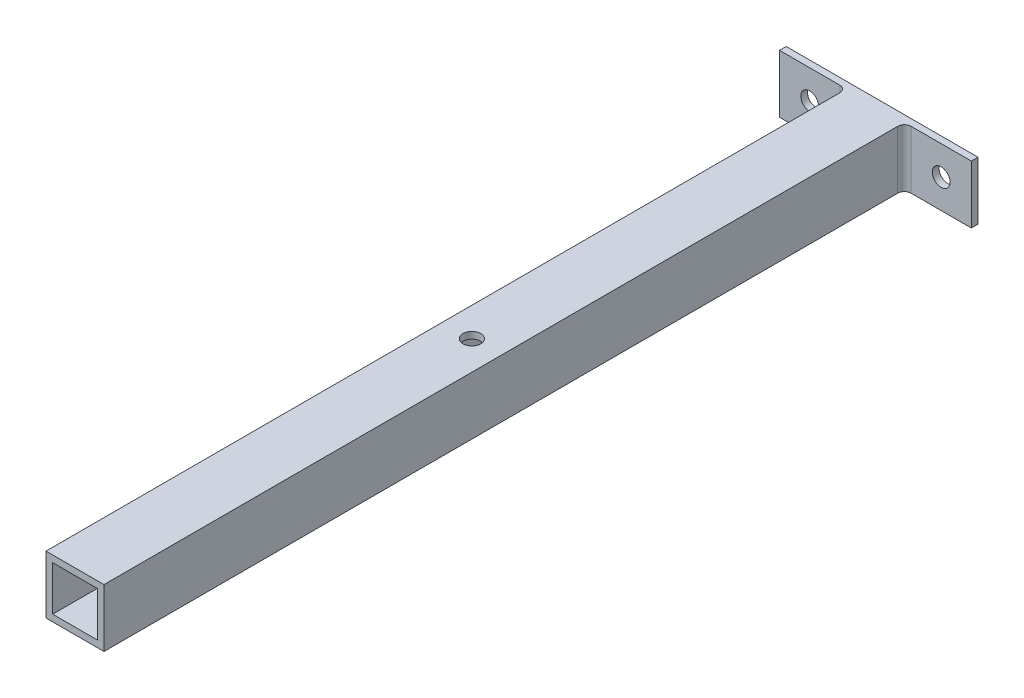
from build123d import *

# Parameters (mm, degrees)
BOSS_EXTRUDE1_DEPTH = 26
SHELL1_START        = -10
SHELL1_OUTLINE_W    = 20
SHELL1_OUTLINE_H    = 362
SHELL1_DEPTH        = 20
FILLET1_R           = 3
SKETCH3_R           = 4
CUT_EXTRUDE1_DEPTH  = 3
SKETCH4_R           = 4
CUT_EXTRUDE2_DEPTH  = 37


# Read off the part's stored shape, not the designer's step: Shell1
with BuildPart() as part:
    # Sketch2 → Boss-Extrude1 (new body)
    with BuildSketch(Plane(origin=(0, 0, 0), x_dir=(1, 0, 0), z_dir=(0, 1, 0))):
        Polygon((-13, 181), (-43, 181), (-43, 178), (-13, 178), (-13, -181), (13, -181), (13, 178), (43, 178), (43, 181), (13, 181), align=None)
    extrude(amount=BOSS_EXTRUDE1_DEPTH)

    # Shell1 outline → Shell1 (cut)
    with BuildSketch(Plane.YZ.offset(SHELL1_START)):
        with Locations((13, 0)):
            Rectangle(SHELL1_OUTLINE_W, SHELL1_OUTLINE_H)
    extrude(amount=SHELL1_DEPTH, mode=Mode.SUBTRACT)

    # Fillet1
    fillet1_edges = [part.edges().sort_by_distance(p)[0] for p in [
        (-13, 13, -178),
        (13, 13, -178),
        (10, 13, -181),
        (-10, 13, -181),
    ]]
    fillet(fillet1_edges, radius=FILLET1_R)

    # Sketch3 → Cut-Extrude1 (cut)
    with BuildSketch(Plane.XY.offset(-178)):
        with Locations((29.5, 13)):
            Circle(SKETCH3_R)
        with Locations(Location((-29.5, 13, 0), (0, 0, 180))):
            Circle(SKETCH3_R)
    extrude(amount=-CUT_EXTRUDE1_DEPTH, mode=Mode.SUBTRACT)

    # Sketch4 → Cut-Extrude2 (cut)
    with BuildSketch(Plane(origin=(0, 26, 0), x_dir=(1, 0, 0), z_dir=(0, 1, 0))):
        with Locations(Location((0, -3, 0), (0, 0, 270))):
            Circle(SKETCH4_R)
    extrude(amount=-CUT_EXTRUDE2_DEPTH, mode=Mode.SUBTRACT)


solid = part.part
